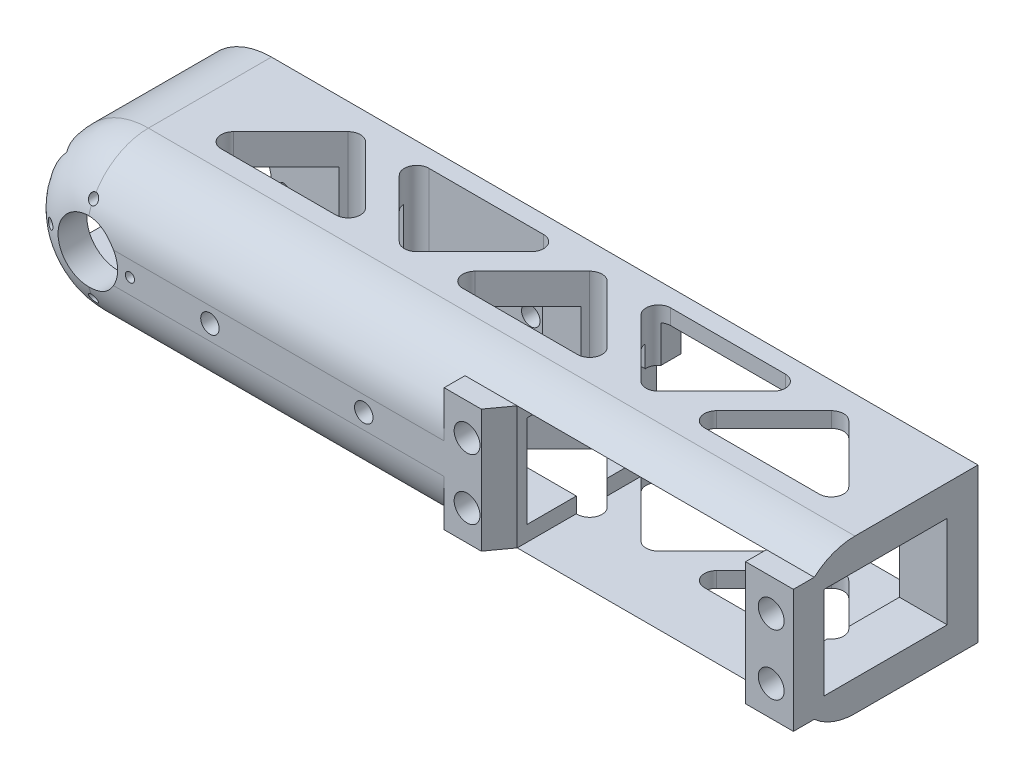
from build123d import *

# Parameters (mm, degrees)
SKIZZE1_R                        = 5
AUFSATZ_LINEAR_AUSTRAGEN1_DEPTH  = 30
SKIZZE3_R                        = 10.45
SCHNITT_LINEAR_AUSTRAGEN2_DEPTH  = 2
SKIZZE4_W                        = 40.5
SKIZZE4_H                        = 20
SCHNITT_LINEAR_AUSTRAGEN3_DEPTH  = 54
SKIZZE5_W                        = 20
SKIZZE5_H                        = 15
SCHNITT_LINEAR_AUSTRAGEN4_DEPTH  = 138
SKIZZE6_R                        = 2.1
SCHNITT_LINEAR_AUSTRAGEN5_DEPTH  = 16
SKIZZE7_R                        = 2.1
SCHNITT_LINEAR_AUSTRAGEN6_DEPTH  = 16
VERRUNDUNG2_START                = 2.682884174
VERRUNDUNG2_DEPTH                = 127.317115826
VERRUNDUNG2_2_ANGLE              = 180
AUFSATZ_LINEAR_START             = -3.385622
SKIZZE8_W                        = 8.480079342
SKIZZE8_H                        = 20
SKIZZE8_R                        = 2.1
SKIZZE8_W_2                      = 7.76974371
AUFSATZ_LINEAR_AUSTRAGEN2_DEPTH  = 3.385622
SCHNITT_LINEAR_AUSTRAGEN7_DEPTH  = 37
SKIZZE10_R                       = 0.75
SCHNITT_LINEAR_AUSTRAGEN8_DEPTH  = 37
SKIZZE11_R                       = 1.5
SCHNITT_LINEAR_AUSTRAGEN9_DEPTH  = 37
SKIZZE12_W                       = 4
SKIZZE12_H                       = 8
SCHNITT_LINEAR_AUSTRAGEN10_DEPTH = 10
SCHNITT_LINEAR_AUSTRAGEN11_DEPTH = 24


with BuildPart() as part:
    # Skizze1 → Aufsatz-Linear austragen1 (new body)
    with BuildSketch(Plane.XY):
        with BuildLine():
            Line((15.182884174, 0), (130, 0))
            Line((130, 0), (130, 25))
            Line((130, 25), (15.182884174, 25))
            ThreePointArc((15.182884174, 25), (2.682884174, 12.5), (15.182884174, 0))
        make_face()
        with Locations((15.182884174, 12.5)):
            Circle(SKIZZE1_R, mode=Mode.SUBTRACT)
    extrude(amount=AUFSATZ_LINEAR_AUSTRAGEN1_DEPTH)

    # Skizze3 → Schnitt-Linear austragen2 (cut)
    with BuildSketch(Plane(origin=(0, 0, 0), x_dir=(-1, 0, 0), z_dir=(0, 0, -1))):
        with Locations((-15.182884174, 12.5)):
            Circle(SKIZZE3_R)
    extrude(amount=-SCHNITT_LINEAR_AUSTRAGEN2_DEPTH, mode=Mode.SUBTRACT)

    # Skizze4 → Schnitt-Linear austragen3 (cut)
    with BuildSketch(Plane.XY.offset(30)):
        with Locations((101.98025629, 12.5)):
            Rectangle(SKIZZE4_W, SKIZZE4_H)
    extrude(amount=-SCHNITT_LINEAR_AUSTRAGEN3_DEPTH, mode=Mode.SUBTRACT)

    # Skizze5 → Schnitt-Linear austragen4 (cut)
    with BuildSketch(Plane(origin=(130, 0, 0), x_dir=(0, 0, -1), z_dir=(1, 0, 0))):
        with Locations((-15, 12.5)):
            Rectangle(SKIZZE5_W, SKIZZE5_H)
    extrude(amount=-SCHNITT_LINEAR_AUSTRAGEN4_DEPTH, mode=Mode.SUBTRACT)

    # Skizze6 → Schnitt-Linear austragen5 (cut)
    with BuildSketch(Plane.XY.offset(30)):
        with Locations((76.969110672, 17.275)):
            Circle(SKIZZE6_R)
        with Locations((126.391401908, 17.275)):
            Circle(SKIZZE6_R)
    extrude(amount=-SCHNITT_LINEAR_AUSTRAGEN5_DEPTH, mode=Mode.SUBTRACT)

    # Skizze7 → Schnitt-Linear austragen6 (cut)
    with BuildSketch(Plane.XY.offset(30)):
        with Locations((76.969110672, 7.425)):
            Circle(SKIZZE7_R)
        with Locations((126.391401908, 7.425)):
            Circle(SKIZZE7_R)
    extrude(amount=-SCHNITT_LINEAR_AUSTRAGEN6_DEPTH, mode=Mode.SUBTRACT)

    # Verrundung2: read off the stored shape, not the designer's step
    # Verrundung2 outline → Verrundung2 (cut)
    with BuildSketch(Plane.YZ.offset(VERRUNDUNG2_START)):
        with BuildLine():
            Line((0, 30), (0, 20))
            ThreePointArc((0, 20), (2.928932188, 27.071067812), (10, 30))
            Line((10, 30), (0, 30))
        make_face()
        with BuildLine():
            ThreePointArc((15, 30), (22.071067812, 27.071067812), (25, 20))
            Line((25, 20), (25, 30))
            Line((25, 30), (15, 30))
        make_face()
    extrude(amount=VERRUNDUNG2_DEPTH, mode=Mode.SUBTRACT)

    # Verrundung2 2 outline → Verrundung2 2 (revolve, cut)
    with BuildSketch(Plane(origin=(15.182884174, 12.5, 0), x_dir=(0, 1, 0), z_dir=(1, 0, 0))):
        with BuildLine():
            ThreePointArc((5, 29.682458366), (10.40569415, 26.123724357), (12.5, 20))
            Line((12.5, 20), (12.5, 30))
            Line((12.5, 30), (5, 30))
            Line((5, 30), (5, 29.682458366))
        make_face()
    revolve(axis=Axis((15.182884174, 12.5, 0), (0, 0, 1)), revolution_arc=VERRUNDUNG2_2_ANGLE, mode=Mode.SUBTRACT)

    # Skizze8 → Aufsatz-Linear austragen2 (add)
    # profile 1 of 2: a face of its own
    with BuildSketch(Plane.XY.offset(30).offset(AUFSATZ_LINEAR_START)):
        with Locations((77.490216619, 12.5)):
            Rectangle(SKIZZE8_W, SKIZZE8_H)
        with Locations((76.969110672, 17.275)):
            Circle(SKIZZE8_R, mode=Mode.SUBTRACT)
        with Locations((76.969110672, 7.425)):
            Circle(SKIZZE8_R, mode=Mode.SUBTRACT)
    # profile 2 of 2: a face of its own
    with BuildSketch(Plane.XY.offset(30).offset(AUFSATZ_LINEAR_START)):
        with Locations((126.115128145, 12.5)):
            Rectangle(SKIZZE8_W_2, SKIZZE8_H)
        with Locations((126.391401908, 7.425)):
            Circle(SKIZZE8_R, mode=Mode.SUBTRACT)
        with Locations((126.391401908, 17.275)):
            Circle(SKIZZE8_R, mode=Mode.SUBTRACT)
    extrude(amount=AUFSATZ_LINEAR_AUSTRAGEN2_DEPTH)

    # Skizze9 → Schnitt-Linear austragen7 (cut)
    with BuildSketch(Plane(origin=(0, 25, 0), x_dir=(1, 0, 0), z_dir=(0, 1, 0))):
        with BuildLine():
            Line((22.597097736, -13.585786438), (31.910806235, -4.272077939))
            ThreePointArc((31.910806235, -4.272077939), (33.325019798, -3.686291501), (34.73923336, -4.272077939))
            Line((34.73923336, -4.272077939), (44.052941859, -13.585786438))
            ThreePointArc((44.052941859, -13.585786438), (44.486487362, -15.765366865), (42.638728296, -17))
            Line((42.638728296, -17), (24.011311299, -17))
            ThreePointArc((24.011311299, -17), (22.163552234, -15.765366865), (22.597097736, -13.585786438))
        make_face()
        with BuildLine():
            Line((61.863520026, -13.585786438), (71.177228525, -4.272077939))
            ThreePointArc((71.177228525, -4.272077939), (72.591442087, -3.686291501), (74.005655649, -4.272077939))
            Line((74.005655649, -4.272077939), (83.319364148, -13.585786438))
            ThreePointArc((83.319364148, -13.585786438), (83.752909651, -15.765366865), (81.905150586, -17))
            Line((81.905150586, -17), (63.277733588, -17))
            ThreePointArc((63.277733588, -17), (61.429974523, -15.765366865), (61.863520026, -13.585786438))
        make_face()
        with BuildLine():
            Line((101.129942315, -13.585786438), (110.443650814, -4.272077939))
            ThreePointArc((110.443650814, -4.272077939), (111.857864376, -3.686291501), (113.272077939, -4.272077939))
            Line((113.272077939, -4.272077939), (122.585786438, -13.585786438))
            ThreePointArc((122.585786438, -13.585786438), (123.01933194, -15.765366865), (121.171572875, -17))
            Line((121.171572875, -17), (102.544155877, -17))
            ThreePointArc((102.544155877, -17), (100.696396812, -15.765366865), (101.129942315, -13.585786438))
        make_face()
        with BuildLine():
            Line((63.677228525, -6.274213562), (54.363520026, -15.587922061))
            ThreePointArc((54.363520026, -15.587922061), (52.949306463, -16.173708499), (51.535092901, -15.587922061))
            Line((51.535092901, -15.587922061), (42.221384402, -6.274213562))
            ThreePointArc((42.221384402, -6.274213562), (41.787838899, -4.094633135), (43.635597964, -2.86))
            Line((43.635597964, -2.86), (62.263014962, -2.86))
            ThreePointArc((62.263014962, -2.86), (64.110774027, -4.094633135), (63.677228525, -6.274213562))
        make_face()
        with BuildLine():
            Line((102.961499772, -6.274213562), (93.647791273, -15.587922061))
            ThreePointArc((93.647791273, -15.587922061), (92.233577711, -16.173708499), (90.819364148, -15.587922061))
            Line((90.819364148, -15.587922061), (81.505655649, -6.274213562))
            ThreePointArc((81.505655649, -6.274213562), (81.072110147, -4.094633135), (82.919869212, -2.86))
            Line((82.919869212, -2.86), (101.54728621, -2.86))
            ThreePointArc((101.54728621, -2.86), (103.395045275, -4.094633135), (102.961499772, -6.274213562))
        make_face()
    extrude(amount=-SCHNITT_LINEAR_AUSTRAGEN7_DEPTH, mode=Mode.SUBTRACT)

    # Skizze10 → Schnitt-Linear austragen8 (cut)
    with BuildSketch(Plane(origin=(0, 0, 2), x_dir=(-1, 0, 0), z_dir=(0, 0, -1))):
        with Locations((-15.182884174, 19.5)):
            Circle(SKIZZE10_R)
        with Locations((-15.182884174, 5.5)):
            Circle(SKIZZE10_R)
        with Locations(Location((-8.182884174, 12.5, 0), (0, 0, 328.209378263))):
            Circle(SKIZZE10_R)
        with Locations(Location((-22.182884174, 12.5, 0), (0, 0, 270))):
            Circle(SKIZZE10_R)
    extrude(amount=-SCHNITT_LINEAR_AUSTRAGEN8_DEPTH, mode=Mode.SUBTRACT)

    # Skizze11 → Schnitt-Linear austragen9 (cut)
    with BuildSketch(Plane.XY.offset(30)):
        with Locations((35.182884174, 12.5)):
            Circle(SKIZZE11_R)
        with Locations((60.182884174, 12.5)):
            Circle(SKIZZE11_R)
    extrude(amount=-SCHNITT_LINEAR_AUSTRAGEN9_DEPTH, mode=Mode.SUBTRACT)

    # Skizze12 → Schnitt-Linear austragen10 (cut)
    with BuildSketch(Plane(origin=(0, 0, 0), x_dir=(-1, 0, 0), z_dir=(0, 0, -1))):
        with Locations((-79.73025629, 12.5)):
            Rectangle(SKIZZE12_W, SKIZZE12_H)
    extrude(amount=-SCHNITT_LINEAR_AUSTRAGEN10_DEPTH, mode=Mode.SUBTRACT)

    # Skizze13 → Schnitt-Linear austragen11 (cut)
    with BuildSketch(Plane.XZ.offset(-2.5)):
        Polygon((79.276504232, 30), (81.73025629, 26.614378278), (81.73025629, 30), align=None)
    extrude(amount=-SCHNITT_LINEAR_AUSTRAGEN11_DEPTH, mode=Mode.SUBTRACT)


solid = part.part
